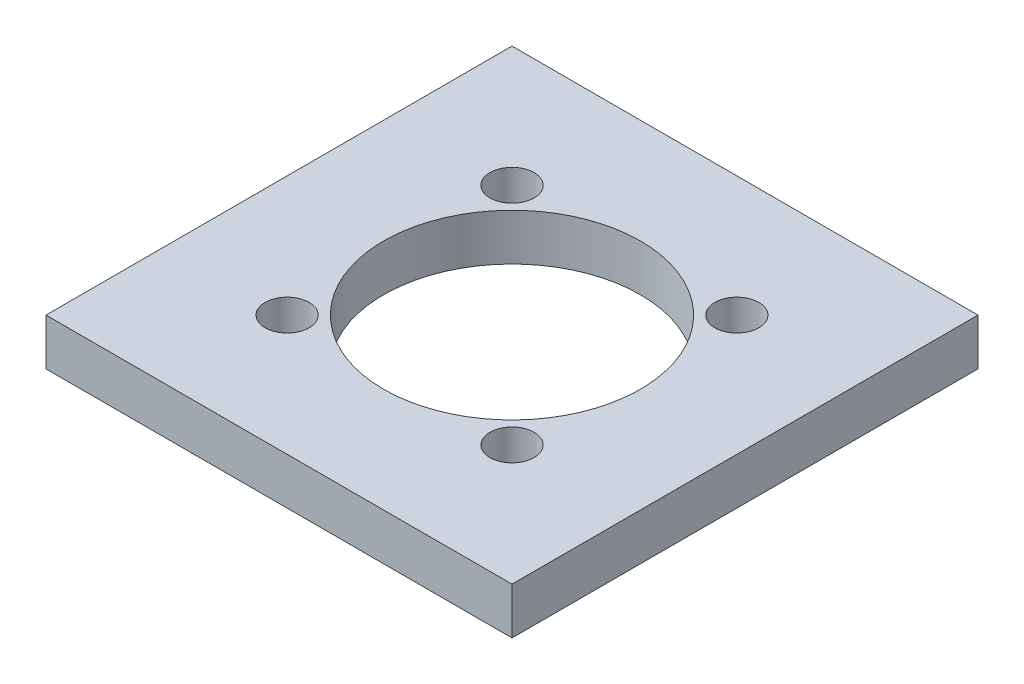
from build123d import *

# Parameters (mm, degrees)
SKETCH2_W            = 38.1
SKETCH2_H            = 38.1
BOSS_EXTRUDE1_DEPTH  = 3.81
SKETCH4_R            = 10.5
CUT_EXTRUDE1_DEPTH   = 28.208842313
M3_CLEARANCE_HOLE2_D = 3.6


with BuildPart() as part:
    # Sketch2 → Boss-Extrude1 (new body)
    with BuildSketch(Plane(origin=(0, 0, 0), x_dir=(1, 0, 0), z_dir=(0, 1, 0))):
        Rectangle(SKETCH2_W, SKETCH2_H)
    extrude(amount=BOSS_EXTRUDE1_DEPTH)

    # Sketch4 → Cut-Extrude1 (cut, through all)
    with BuildSketch(Plane(origin=(0, 3.81, 0), x_dir=(1, 0, 0), z_dir=(0, 1, 0))):
        Circle(SKETCH4_R)
    extrude(amount=-CUT_EXTRUDE1_DEPTH, mode=Mode.SUBTRACT)

    # M3 Clearance Hole2 (through all)
    with Locations(Plane(origin=(-9.192388155, 3.81, -9.192388155), x_dir=(0, 0, 1), z_dir=(0, 1, 0))):
        with Locations((0, 0), (18.38477631, 18.38477631), (0, 18.38477631), (18.38477631, 0)):
            Hole(M3_CLEARANCE_HOLE2_D / 2)


solid = part.part
